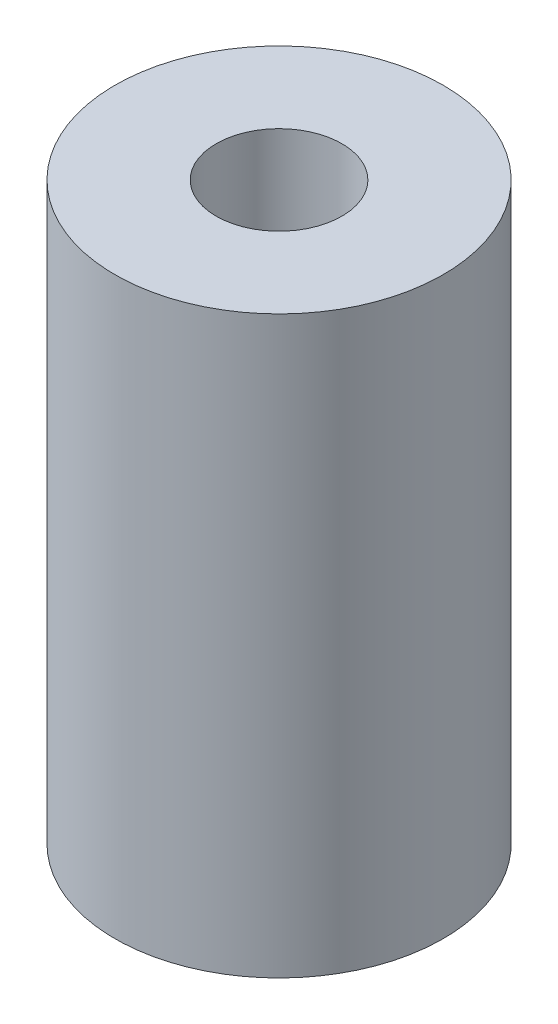
from build123d import *

# Parameters (mm, degrees)
SKETCH1_R           = 23.5
BOSS_EXTRUDE1_DEPTH = 82.35
SKETCH2_R           = 9
CUT_EXTRUDE1_DEPTH  = 100


with BuildPart() as part:
    # Sketch1 → Boss-Extrude1 (new body)
    with BuildSketch(Plane(origin=(0, 0, 0), x_dir=(1, 0, 0), z_dir=(0, 1, 0))):
        Circle(SKETCH1_R)
    extrude(amount=BOSS_EXTRUDE1_DEPTH)

    # Sketch2 → Cut-Extrude1 (cut)
    with BuildSketch(Plane(origin=(0, 82.35, 0), x_dir=(1, 0, 0), z_dir=(0, 1, 0))):
        Circle(SKETCH2_R)
    extrude(amount=-CUT_EXTRUDE1_DEPTH, mode=Mode.SUBTRACT)


solid = part.part
